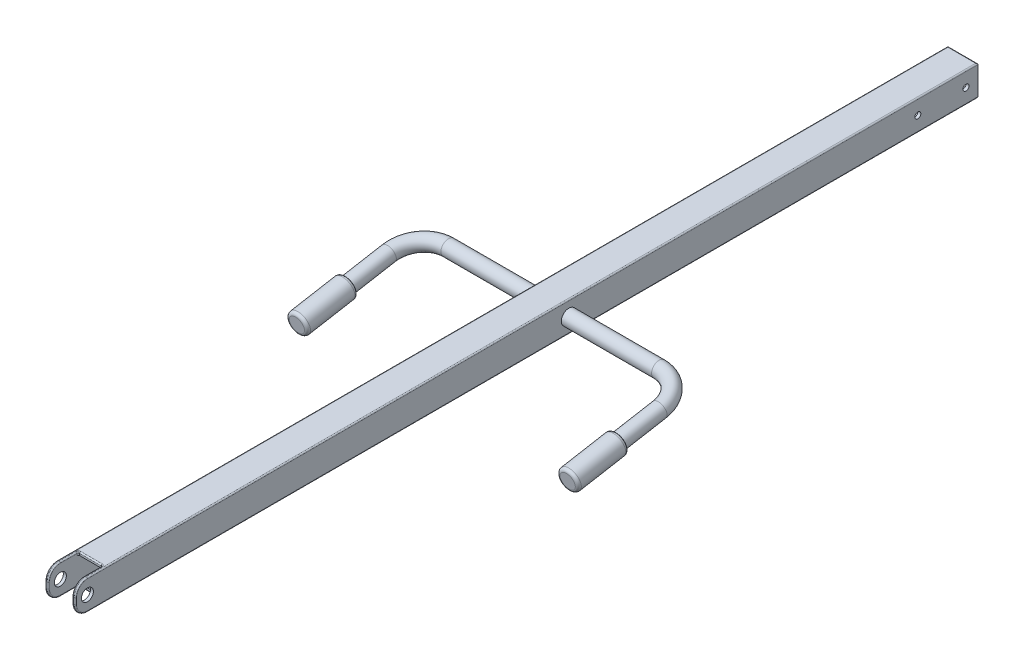
from build123d import *

# Parameters (mm, degrees)
SKETCH_1_W             = 50
SKETCH_1_H             = 50
SKETCH_1_W_2           = 40
SKETCH_1_H_2           = 40
EXTRUDE_1_DEPTH        = 1500
SKETCH_2_R             = 5
SKETCH_2_R_2           = 10
CUT_EXTRUDE_1_DEPTH    = 1502.041305228
SKETCH_4_W             = 40
SKETCH_4_H             = 50
CUT_EXTRUDE_2_DEPTH    = 1502.041305228
FILLET_1_R             = 20
FILLET_6_R             = 2
SKETCH_7_R             = 5
CUT_EXTRUDE_3_DEPTH    = 10
SKETCH_8_R             = 12.5
SKETCH_8_R_2           = 10.5
SKETCH_10_R            = 17.5
SKETCH_10_R_2          = 12.5
EXTRUDE_2_DEPTH        = 80
EXTRUDE_START          = 5
SKETCH_11_R            = 17.5
EXTRUDE_1_2_DEPTH      = 5
FILLET_7_R             = 5
FILLET_7_OF_MIRROR_1_R = 5


with BuildPart() as part:
    # 草图1 → Extrude 1 (new body)
    with BuildSketch(Plane.XY):
        Rectangle(SKETCH_1_W, SKETCH_1_H)
        Rectangle(SKETCH_1_W_2, SKETCH_1_H_2, mode=Mode.SUBTRACT)
    extrude(amount=EXTRUDE_1_DEPTH)

    # 草图2 → 切除-拉伸1 (cut, through all)
    with BuildSketch(Plane(origin=(25, 0, 0), x_dir=(0, 0, -1), z_dir=(1, 0, 0))):
        with Locations(Location((-20, 0, 0), (0, 0, 90))):
            Circle(SKETCH_2_R)
        with Locations(Location((-100, 0, 0), (0, 0, 90))):
            Circle(SKETCH_2_R)
        with Locations(Location((-1480, 0, 0), (0, 0, 90))):
            Circle(SKETCH_2_R_2)
    extrude(amount=-CUT_EXTRUDE_1_DEPTH, mode=Mode.SUBTRACT)

    # 草图4 → 切除-拉伸2 (cut, through all)
    with BuildSketch(Plane(origin=(0, 25, 0), x_dir=(1, 0, 0), z_dir=(0, 1, 0))):
        with Locations((0, -1475)):
            Rectangle(SKETCH_4_W, SKETCH_4_H)
    extrude(amount=-CUT_EXTRUDE_2_DEPTH, mode=Mode.SUBTRACT)

    # 圆角1
    fillet_1_edges = [part.edges().sort_by_distance(p)[0] for p in [
        (22.5, 25, 1500),
        (-22.5, 25, 1500),
        (22.5, -25, 1500),
        (-22.5, -25, 1500),
    ]]
    fillet(fillet_1_edges, radius=FILLET_1_R)

    # 圆角6
    fillet_6_edges = [part.edges().sort_by_distance(p)[0] for p in [
        (0, 25, 0),
        (0, -25, 0),
        (0, -25, 1450),
        (-20, -22.5, 1450),
        (20, -22.5, 1450),
        (20, 22.5, 1450),
        (-20, -25, 1465),
        (-20, 22.5, 1450),
        (0, 25, 1450),
        (-20, 25, 1465),
        (20, 0, 1500),
        (25, 0, 1500),
        (25, 25, 740),
        (25, -25, 740),
        (25, 19.142135624, 1494.142135624),
        (25, -19.142135624, 1494.142135624),
        (20, -25, 1465),
        (-25, -25, 740),
        (20, 25, 1465),
        (20, 19.142135624, 1494.142135624),
        (20, -19.142135624, 1494.142135624),
        (-20, 0, 1500),
        (-25, 0, 1500),
        (-20, 19.142135624, 1494.142135624),
        (-20, -19.142135624, 1494.142135624),
        (-25, 25, 740),
        (-25, 19.142135624, 1494.142135624),
        (-25, -19.142135624, 1494.142135624),
    ]]
    fillet(fillet_6_edges, radius=FILLET_6_R)

    # 草图7 → 切除-拉伸3 (cut)
    with BuildSketch(Plane.XZ.offset(25)):
        with Locations(Location((0, 680, 0), (0, 0, 270))):
            Circle(SKETCH_7_R)
    extrude(amount=-CUT_EXTRUDE_3_DEPTH, mode=Mode.SUBTRACT)

    # 扫描1: sweep along a path in 草图9
    with BuildLine(Plane(origin=(0, 116.286848731, 20.504508933), x_dir=(1, 0, 0), z_dir=(0, 0.984807753012208, 0.17364817766693072))) as sweep_1_path:
        Line((-25, -669.669272048), (-175, -669.669272048))
        ThreePointArc((-175, -669.669272048), (-210.355339059, -684.313932989), (-225, -719.669272048))
        Line((-225, -719.669272048), (-225, -869.669272048))
    # 草图8 → 扫描1 (sweep)
    with BuildSketch(Plane.ZY.offset(25)):
        with Locations((680, 0)):
            Circle(SKETCH_8_R)
        with Locations((680, 0)):
            Circle(SKETCH_8_R_2, mode=Mode.SUBTRACT)
    sweep_1 = sweep(path=sweep_1_path.line)

    # 草图10 → 拉伸-薄壁2 (add)
    with BuildSketch(Plane(origin=(0, -151.016484264, 856.45704167), x_dir=(1, 0, 0), z_dir=(0, -0.17364817766693091, 0.9848077530122081))):
        with Locations((-225, 118.080760814)):
            Circle(SKETCH_10_R)
        with Locations((-225, 118.080760814)):
            Circle(SKETCH_10_R_2, mode=Mode.SUBTRACT)
    extrude_2 = extrude(amount=-EXTRUDE_2_DEPTH)

    # 草图11 → Extrude 1 2 (add)
    with BuildSketch(Plane(origin=(0, -151.016484264, 856.45704167), x_dir=(1, 0, 0), z_dir=(0, -0.17364817766693091, 0.9848077530122081)).offset(EXTRUDE_START)):
        with Locations(Location((-225, 118.080760814, 0), (0, 0, 270))):
            Circle(SKETCH_11_R)
    extrude_1_2 = extrude(amount=-EXTRUDE_1_2_DEPTH)

    # 圆角7
    # the kernel refuses this fillet: 5 mm, written as the material it takes off along each edge
    with BuildSketch(Plane(origin=(-225, -20.83778132, 798.176930361), x_dir=(1, 0, 0), z_dir=(0, -0.9848077530122081, -0.17364817766693091))) as fillet_7_piece_1:
        with BuildLine():
            CenterArc((17.5 - FILLET_7_R, FILLET_7_R), FILLET_7_R, 270, 90)
            Line((17.5, FILLET_7_R), (17.5, 0))
            Line((17.5, 0), (17.5 - FILLET_7_R, 0))
        make_face()
    revolve(axis=Axis((-225, -20.83778132, 798.176930361), (0, -0.17364817766693091, 0.9848077530122081)), mode=Mode.SUBTRACT)
    with BuildSketch(Plane(origin=(-225, -35.597876422, 881.885589368), x_dir=(0, -0.9848077530122085, -0.17364817766692792), z_dir=(-1, 0, 0))) as fillet_7_piece_2:
        with BuildLine():
            CenterArc((17.5 - FILLET_7_R, -FILLET_7_R), FILLET_7_R, 0, 90)
            Line((17.5 - FILLET_7_R, 0), (17.5, 0))
            Line((17.5, 0), (17.5, -FILLET_7_R))
        make_face()
    revolve(axis=Axis((-225, -35.597876422, 881.885589368), (0, -0.17364817766693091, 0.9848077530122081)), mode=Mode.SUBTRACT)

    # 镜向1: 扫描1, 拉伸-薄壁2, Extrude 1 2 across plane
    add(sweep_1.mirror(Plane.ZY))
    add(extrude_2.mirror(Plane.ZY))
    add(extrude_1_2.mirror(Plane.ZY))

    # 圆角7 of 镜向1
    # the kernel refuses this fillet: 5 mm, written as the material it takes off along each edge
    with BuildSketch(Plane(origin=(225, -20.83778132, 798.176930361), x_dir=(-1, 0, 0), z_dir=(0, -0.9848077530122081, -0.17364817766693091))) as fillet_7_of_mirror_1_piece_1:
        with BuildLine():
            CenterArc((17.5 - FILLET_7_OF_MIRROR_1_R, -FILLET_7_OF_MIRROR_1_R), FILLET_7_OF_MIRROR_1_R, 360, 90)
            Line((17.5, -FILLET_7_OF_MIRROR_1_R), (17.5, 0))
            Line((17.5, 0), (17.5 - FILLET_7_OF_MIRROR_1_R, 0))
        make_face()
    revolve(axis=Axis((225, -20.83778132, 798.176930361), (0, 0.17364817766693091, -0.9848077530122081)), mode=Mode.SUBTRACT)
    with BuildSketch(Plane(origin=(225, -35.597876422, 881.885589368), x_dir=(0, -0.9848077530122085, -0.17364817766692792), z_dir=(1, 0, 0))) as fillet_7_of_mirror_1_piece_2:
        with BuildLine():
            CenterArc((17.5 - FILLET_7_OF_MIRROR_1_R, FILLET_7_OF_MIRROR_1_R), FILLET_7_OF_MIRROR_1_R, 270, 90)
            Line((17.5 - FILLET_7_OF_MIRROR_1_R, 0), (17.5, 0))
            Line((17.5, 0), (17.5, FILLET_7_OF_MIRROR_1_R))
        make_face()
    revolve(axis=Axis((225, -35.597876422, 881.885589368), (0, 0.17364817766693091, -0.9848077530122081)), mode=Mode.SUBTRACT)


solid = part.part
